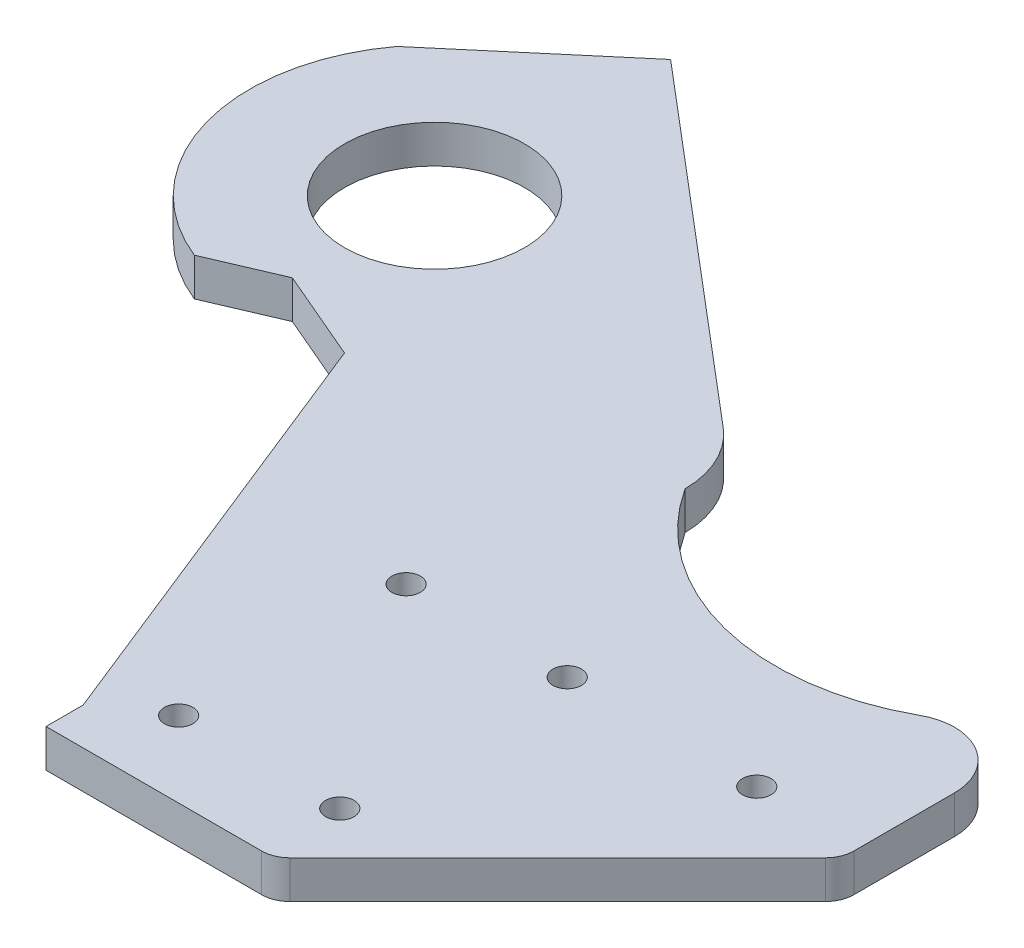
from build123d import *

# Parameters (mm, degrees)
SKETCH_2_R          = 1.5
SKETCH_2_R_2        = 9.5
EXTRUDE_1_DEPTH     = 4
CUT_EXTRUDE_1_DEPTH = 124.429075185
EXTRUDE_2_DEPTH     = 4
SKETCH_7_R          = 1.5
CUT_EXTRUDE_2_DEPTH = 155.008884812
CUT_EXTRUDE_5_DEPTH = 155.008884812
FILLET_4_R          = 3
FILLET_5_R          = 6
FILLET_6_R          = 10
CHAMFER_1_SIZE      = 20
CHAMFER_1_SIZE2     = 38.078865529


with BuildPart() as part:
    # 草图2 → 凸台-拉伸1 (new body)
    with BuildSketch(Plane(origin=(0, 0, 0), x_dir=(1, 0, 0), z_dir=(0, 1, 0))):
        Polygon((0, 0), (0, 60), (40, 93.908128514), (80, 60), (80, 0), (68, 0), (68, 42), (40, 54), (12, 42), (12, 0), align=None)
        with Locations(Location((6, 32, 0), (0, 0, 270))):
            Circle(SKETCH_2_R, mode=Mode.SUBTRACT)
        with Locations(Location((6, 8, 0), (0, 0, 270))):
            Circle(SKETCH_2_R, mode=Mode.SUBTRACT)
        with Locations(Location((40, 69, 0), (0, 0, 270))):
            Circle(SKETCH_2_R_2, mode=Mode.SUBTRACT)
        with Locations(Location((74, 8, 0), (0, 0, 90))):
            Circle(SKETCH_2_R, mode=Mode.SUBTRACT)
        with Locations(Location((74, 32, 0), (0, 0, 90))):
            Circle(SKETCH_2_R, mode=Mode.SUBTRACT)
    extrude(amount=EXTRUDE_1_DEPTH)

    # 草图4 → 切除-拉伸1 (cut, through all)
    with BuildSketch(Plane(origin=(0, 4, 0), x_dir=(1, 0, 0), z_dir=(0, 1, 0))):
        with BuildLine():
            Line((24.36723091, 80.656179931), (0, 60))
            Line((0, 60), (0, 0))
            Line((0, 0), (12, 0))
            Line((12, 0), (12, 42))
            Line((12, 42), (32.756034747, 50.895443463))
            ThreePointArc((32.756034747, 50.895443463), (21.23136653, 63.709593809), (24.36723091, 80.656179931))
        make_face()
    extrude(amount=-CUT_EXTRUDE_1_DEPTH, mode=Mode.SUBTRACT)

    # 草图6 → 凸台-拉伸2 (add)
    with BuildSketch(Plane(origin=(0, 4, 0), x_dir=(1, 0, 0), z_dir=(0, 1, 0))):
        with BuildLine():
            ThreePointArc((122, 55.435340034), (101, 44), (80, 55.435340034))
            Line((80, 55.435340034), (80, 0))
            Line((80, 0), (122, 0))
            Line((122, 0), (122, 55.435340034))
        make_face()
    extrude(amount=-EXTRUDE_2_DEPTH)

    # 草图7 → 切除-拉伸2 (cut, through all)
    with BuildSketch(Plane(origin=(0, 4, 0), x_dir=(1, 0, 0), z_dir=(0, 1, 0))):
        with Locations(Location((91, 32, 0), (0, 0, 270))):
            Circle(SKETCH_7_R)
        with Locations(Location((74, 32, 0), (0, 0, 90))):
            Circle(SKETCH_7_R)
        with Locations(Location((74, 8, 0), (0, 0, 90))):
            Circle(SKETCH_7_R)
        with Locations(Location((111, 32, 0), (0, 0, 270))):
            Circle(SKETCH_7_R)
        with Locations(Location((111, 8, 0), (0, 0, 270))):
            Circle(SKETCH_7_R)
        with Locations(Location((91, 8, 0), (0, 0, 270))):
            Circle(SKETCH_7_R)
    extrude(amount=-CUT_EXTRUDE_2_DEPTH, mode=Mode.SUBTRACT)

    # 草图9 → 切除-拉伸5 (cut, through all)
    with BuildSketch(Plane(origin=(0, 4, 0), x_dir=(1, 0, 0), z_dir=(0, 1, 0))):
        Polygon((122, 30), (92, 0), (122, 0), align=None)
    extrude(amount=-CUT_EXTRUDE_5_DEPTH, mode=Mode.SUBTRACT)

    # 圆角4
    fillet_4_edges = [part.edges().sort_by_distance(p)[0] for p in [
        (122, 2, -30),
        (92, 2, 0),
    ]]
    fillet(fillet_4_edges, radius=FILLET_4_R)

    # 圆角5
    fillet_5_edges = [part.edges().sort_by_distance(p)[0] for p in [
        (122, 2, -55.435340034),
    ]]
    fillet(fillet_5_edges, radius=FILLET_5_R)

    # 圆角6
    # the kernel refuses this fillet: 10 mm, written as the material it takes off along each edge
    with BuildSketch(Plane(origin=(80, -11.580514233, -60), x_dir=(0, 0, 1), z_dir=(0, 1, 0))) as fillet_6_piece_1:
        with BuildLine():
            CenterArc((4.632705448, -9.999768488), FILLET_6_R, 90.389874902, 49.322073547)
            Line((-2.995326497, -3.5334613), (-3.147887136, -3.404135157))
            Line((-3.147887136, -3.404135157), (-0.152560639, 0.129326144))
            Line((-0.152560639, 0.129326144), (0, 0.2))
            ThreePointArc((0, 0.2), (2.282329983, 0.2), (4.563299057, 0.19999537))
            Line((4.563299057, 0.19999537), (4.564659966, 0))
        make_face()
    extrude(amount=27.161028465, mode=Mode.SUBTRACT)

    # 倒角1
    chamfer_1_edges = [part.edges().sort_by_distance(p)[0] for p in [
        (68, 2, -42),
    ]]
    chamfer_1_side = [part.faces().sort_by_distance(p)[0] for p in [
        (54, 2, -48),
    ]]
    chamfer(chamfer_1_edges, length=CHAMFER_1_SIZE, length2=CHAMFER_1_SIZE2, reference=chamfer_1_side[0])


solid = part.part
